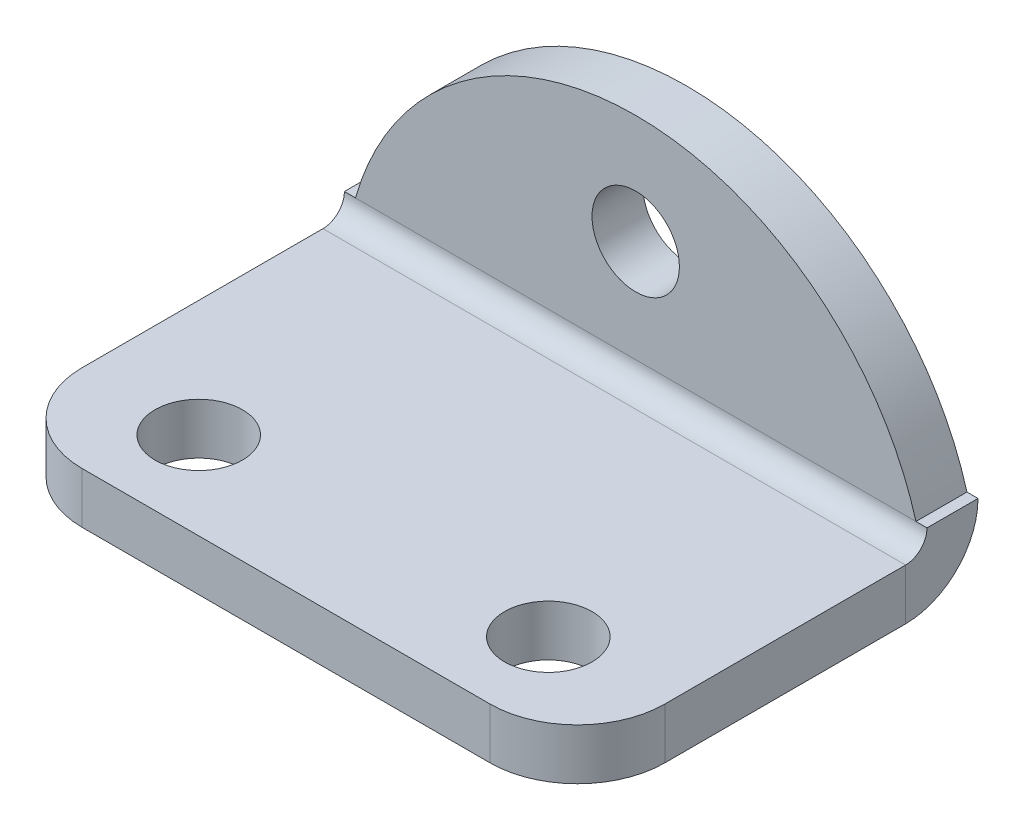
from build123d import *

# Parameters (mm, degrees)
BASE_FLANGE1_DEPTH        = 10
FILLET1_R                 = 3
CORTAR_EXTRUIR1_START     = -1.75
CORTAR_EXTRUIR1_OUTLINE_R = 1.5
CORTAR_EXTRUIR1_DEPTH     = 1.75
CORTAR_EXTRUIR2_REACH     = 20.79
CROQUIS2_R                = 1.5
SCALE1_SCALE              = 0.888888889
CUT_EXTRUDE2_REACH        = 17.649


# Read off the part's stored shape, not the designer's step: Cortar-Extruir1
# Sheet-metal steps are written as plain solids
with BuildPart() as part:
    # Sketch1 → Base-Flange1 (new, symmetric)
    with BuildSketch(Plane(origin=(0, 0, 0), x_dir=(0, 0, -1), z_dir=(1, 0, 0))):
        with BuildLine():
            Line((0, 0), (11.2634, 0))
            ThreePointArc((11.2634, 0), (11.784254855, 0.215745145), (12, 0.7366))
            Line((12, 0.7366), (12, 8))
            Line((12, 8), (13.75, 8))
            Line((13.75, 8), (13.75, 0.7366))
            ThreePointArc((13.75, 0.7366), (13.021691722, -1.021691722), (11.2634, -1.75))
            Line((11.2634, -1.75), (0, -1.75))
            Line((0, -1.75), (0, 0))
        make_face()
    extrude(amount=BASE_FLANGE1_DEPTH, both=True)

    # Fillet1
    fillet1_edges = [part.edges().sort_by_distance(p)[0] for p in [
        (10, -0.875, 0),
        (10, 8, -12.875),
        (-10, -0.875, 0),
        (-10, 8, -12.875),
    ]]
    fillet(fillet1_edges, radius=FILLET1_R)

    # Cortar-Extruir1 outline → Cortar-Extruir1 (cut)
    with BuildSketch(Plane(origin=(0, 0, 0), x_dir=(1, 0, 0), z_dir=(0, 1, 0)).offset(CORTAR_EXTRUIR1_START)):
        with Locations((-6, 3)):
            Circle(CORTAR_EXTRUIR1_OUTLINE_R)
        with Locations((6, 3)):
            Circle(CORTAR_EXTRUIR1_OUTLINE_R)
    extrude(amount=CORTAR_EXTRUIR1_DEPTH, mode=Mode.SUBTRACT)

    # Croquis2 → Cortar-Extruir2 (cut, up to next)
    with BuildSketch(Plane(origin=(0, 0, -13.75), x_dir=(-1, 0, 0), z_dir=(0, 0, -1)), mode=Mode.PRIVATE) as cortar_extruir2_sk1:
        with Locations((0, 4.25)):
            Circle(CROQUIS2_R)
    cortar_extruir2_tool1 = extrude(cortar_extruir2_sk1.sketch, amount=-CORTAR_EXTRUIR2_REACH, mode=Mode.PRIVATE) & part.part
    add(cortar_extruir2_tool1.solids().sort_by_distance((0, 4.25, -13.75))[0], mode=Mode.SUBTRACT)


with BuildPart() as part_1:
    # Scale1: scaled about (0, 0.956325362, -9.128568618)
    add(part.part.scale(SCALE1_SCALE).moved(Location((0, 0.106258374, -1.014285402))))

    # Sketch2 → Cut-Extrude2 (cut, up to next)
    with BuildSketch(Plane.XY.offset(-11.680952069), mode=Mode.PRIVATE) as cut_extrude2_sk1:
        with BuildLine():
            Line((-8.888888889, 4.550702818), (-8.888888889, 0.761013929))
            Line((-8.888888889, 0.761013929), (-8.551720038, 0.761013929))
            ThreePointArc((-8.551720038, 0.761013929), (-5.357621736, 5.42203153), (0, 7.217369485))
            Line((0, 7.217369485), (-6.222222222, 7.217369485))
            ThreePointArc((-6.222222222, 7.217369485), (-8.107840305, 6.436320901), (-8.888888889, 4.550702818))
        make_face()
    cut_extrude2_tool1 = extrude(cut_extrude2_sk1.sketch, amount=-CUT_EXTRUDE2_REACH, mode=Mode.PRIVATE) & part_1.part
    # Sketch2 → Cut-Extrude2 (cut, up to next)
    with BuildSketch(Plane.XY.offset(-11.680952069), mode=Mode.PRIVATE) as cut_extrude2_sk2:
        with BuildLine():
            Line((6.222222222, 7.217369485), (0, 7.217369485))
            ThreePointArc((0, 7.217369485), (5.357621736, 5.42203153), (8.551720038, 0.761013929))
            Line((8.551720038, 0.761013929), (8.888888889, 0.761013929))
            Line((8.888888889, 0.761013929), (8.888888889, 4.550702818))
            ThreePointArc((8.888888889, 4.550702818), (8.107840305, 6.436320901), (6.222222222, 7.217369485))
        make_face()
    cut_extrude2_tool2 = extrude(cut_extrude2_sk2.sketch, amount=-CUT_EXTRUDE2_REACH, mode=Mode.PRIVATE) & part_1.part
    add(cut_extrude2_tool1.solids().sort_by_distance((-6.729341, 5.184457, -11.680952))[0], mode=Mode.SUBTRACT)
    add(cut_extrude2_tool2.solids().sort_by_distance((6.729341, 5.184457, -11.680952))[0], mode=Mode.SUBTRACT)


solid = part_1.part
